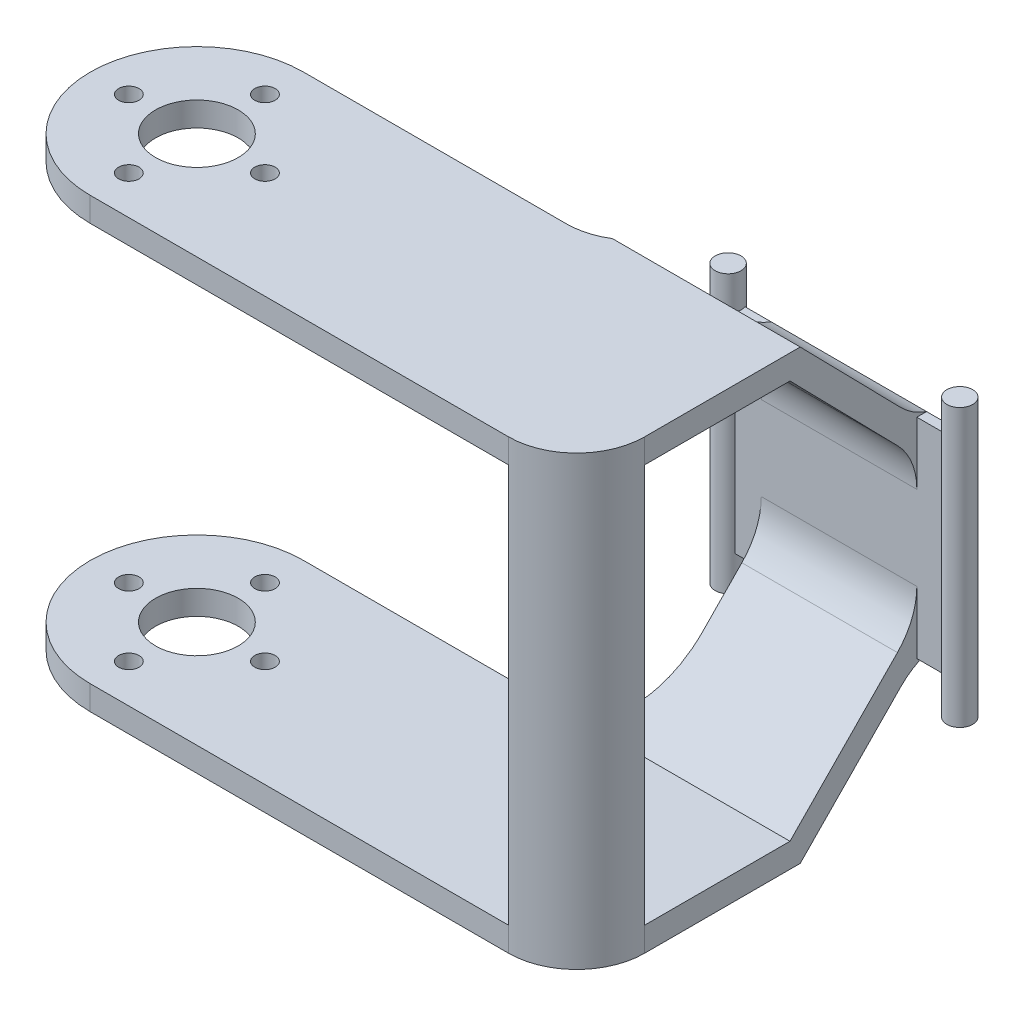
from build123d import *

# Parameters (mm, degrees)
SKETCH1_W           = 23.83
SKETCH1_H           = 1
BOSS_EXTRUDE1_DEPTH = 21.5
SKETCH2_R           = 1.325
BOSS_EXTRUDE2_DEPTH = 14.25
BOSS_EXTRUDE4_DEPTH = 8
SKETCH5_W           = 21.949336604
SKETCH5_H           = 2.5
BOSS_EXTRUDE5_DEPTH = 45
SKETCH6_R           = 4.25
SKETCH6_R_2         = 1.05
CUT_EXTRUDE1_DEPTH  = 79.646360374
FILLET1_R           = 7
FILLET2_R           = 7
FILLET3_R           = 7
BOSS_EXTRUDE6_START = 41
BOSS_EXTRUDE6_DEPTH = 41


with BuildPart() as part:
    # Sketch1 → Boss-Extrude1 (new body)
    with BuildSketch(Plane(origin=(0, 0, 0), x_dir=(1, 0, 0), z_dir=(0, 1, 0))):
        Rectangle(SKETCH1_W, SKETCH1_H)
    extrude(amount=BOSS_EXTRUDE1_DEPTH)

    # Sketch2 → Boss-Extrude2 (add, symmetric)
    with BuildSketch(Plane(origin=(0, 10.75, 0), x_dir=(1, 0, 0), z_dir=(0, 1, 0))):
        with Locations(Location((-11.915, 0, 0), (0, 0, 270))):
            Circle(SKETCH2_R)
        with Locations(Location((11.915, 0, 0), (0, 0, 270))):
            Circle(SKETCH2_R)
    extrude(amount=BOSS_EXTRUDE2_DEPTH, both=True)

    # Sketch4 → Boss-Extrude4 (add, symmetric)
    with BuildSketch(Plane(origin=(0, 0, 0), x_dir=(0, 0, -1), z_dir=(1, 0, 0))):
        Polygon((-0.5, 17.927447783), (-0.5, 21.5), (-12.5, 33.75), (-35.5, 33.75), (-35.5, 31.25), (-13.550663396, 31.25), align=None)
        Polygon((-0.5, 0), (-0.5, 3.572552217), (-13.550663396, -9.75), (-35.5, -9.75), (-35.5, -12.25), (-12.5, -12.25), align=None)
    extrude(amount=BOSS_EXTRUDE4_DEPTH, both=True)

    # Sketch5 → Boss-Extrude5 (add)
    with BuildSketch(Plane.ZY.offset(8)):
        with Locations((24.525331698, 32.5)):
            Rectangle(SKETCH5_W, SKETCH5_H)
        with Locations((24.525331698, -11)):
            Rectangle(SKETCH5_W, SKETCH5_H)
    extrude(amount=BOSS_EXTRUDE5_DEPTH)

    # Sketch6 → Cut-Extrude1 (cut, through all)
    with BuildSketch(Plane(origin=(0, 33.75, 0), x_dir=(1, 0, 0), z_dir=(0, 1, 0))):
        with Locations(Location((-42.025331698, -24.525331698, 0), (0, 0, 270))):
            Circle(SKETCH6_R)
        with Locations(Location((-49.025331698, -24.525331698, 0), (0, 0, 270))):
            Circle(SKETCH6_R_2)
        with Locations(Location((-42.025331698, -17.525331698, 0), (0, 0, 270))):
            Circle(SKETCH6_R_2)
        with Locations(Location((-35.025331698, -24.525331698, 0), (0, 0, 270))):
            Circle(SKETCH6_R_2)
        with Locations(Location((-42.025331698, -31.525331698, 0), (0, 0, 270))):
            Circle(SKETCH6_R_2)
        with BuildLine():
            ThreePointArc((-53, -24.525331698), (-49.785594076, -16.76506932), (-42.025331698, -13.550663396))
            Line((-42.025331698, -13.550663396), (-53, -13.550663396))
            Line((-53, -13.550663396), (-53, -24.525331698))
        make_face()
        with BuildLine():
            ThreePointArc((-42.025331698, -35.5), (-49.785594076, -32.285594076), (-53, -24.525331698))
            Line((-53, -24.525331698), (-53, -35.5))
            Line((-53, -35.5), (-42.025331698, -35.5))
        make_face()
    extrude(amount=-CUT_EXTRUDE1_DEPTH, mode=Mode.SUBTRACT)

    # Fillet1
    # the kernel refuses this fillet: 7 mm, written as the material it adds along each edge
    with BuildSketch(Plane(origin=(-8, -12.25, 13.550663396), x_dir=(-1, 0, 0), z_dir=(0, 1, 0))) as fillet1_piece_1_section:
        with BuildLine():
            CenterArc((FILLET1_R, -FILLET1_R), FILLET1_R, 90, 90)
            Line((0, -FILLET1_R), (0, 0))
            Line((0, 0), (FILLET1_R, 0))
        make_face()
    fillet1_piece_1 = extrude(amount=2.5, mode=Mode.PRIVATE)
    fillet1_piece_1 = split(fillet1_piece_1, bisect_by=Plane(origin=(-10.015975833, -11.661011889, 11.923032054), z_dir=(0, 0.699779834816443, 0.7143585813751185)), keep=Keep.TOP, mode=Mode.PRIVATE)
    fillet1_piece_1 = split(fillet1_piece_1, bisect_by=Plane(origin=(-10.015975833, -9.911562302, 13.708928508), z_dir=(0, -0.6997798348164429, -0.7143585813751187)), keep=Keep.TOP, mode=Mode.PRIVATE)
    add(fillet1_piece_1)
    with BuildSketch(Plane(origin=(-8, -12.25, 13.550663396), x_dir=(-1, 0, 0), z_dir=(0, 1, 0))) as fillet1_piece_2_section:
        with BuildLine():
            CenterArc((FILLET1_R, -FILLET1_R), FILLET1_R, 90, 90)
            Line((0, -FILLET1_R), (0, 0))
            Line((0, 0), (FILLET1_R, 0))
        make_face()
    fillet1_piece_2 = extrude(amount=20, mode=Mode.PRIVATE)
    fillet1_piece_2 = split(fillet1_piece_2, bisect_by=Plane(origin=(-8.812454151, -9.294822672, 9.605132414), z_dir=(0, 0.699779834816443, 0.7143585813751185)), keep=Keep.TOP, mode=Mode.PRIVATE)
    fillet1_piece_2 = split(fillet1_piece_2, bisect_by=Plane(origin=(-8.812454151, -9.75, 10.768831879), z_dir=(0, 1, 0)), keep=Keep.TOP, mode=Mode.PRIVATE)
    fillet1_piece_2 = split(fillet1_piece_2, bisect_by=Plane(origin=(-8.812454151, -7.545373085, 11.391028867), z_dir=(0, -0.6997798348164429, -0.7143585813751187)), keep=Keep.TOP, mode=Mode.PRIVATE)
    add(fillet1_piece_2)
    with BuildSketch(Plane(origin=(-8, 33.75, 13.550663396), x_dir=(0, 0, -1), z_dir=(0, -1, 0))) as fillet1_piece_3_section:
        with BuildLine():
            CenterArc((FILLET1_R, -FILLET1_R), FILLET1_R, 90, 90)
            Line((0, -FILLET1_R), (0, 0))
            Line((0, 0), (FILLET1_R, 0))
        make_face()
    fillet1_piece_3 = extrude(amount=2.5, mode=Mode.PRIVATE)
    fillet1_piece_3 = split(fillet1_piece_3, bisect_by=Plane(origin=(-10.015975833, 31.411562301, 13.708928507), z_dir=(0, 0.6997798348164431, -0.7143585813751184)), keep=Keep.TOP, mode=Mode.PRIVATE)
    fillet1_piece_3 = split(fillet1_piece_3, bisect_by=Plane(origin=(-10.015975833, 33.161011889, 11.923032054), z_dir=(0, -0.699779834816443, 0.7143585813751185)), keep=Keep.TOP, mode=Mode.PRIVATE)
    add(fillet1_piece_3)
    with BuildSketch(Plane(origin=(-8, 33.75, 13.550663396), x_dir=(0, 0, -1), z_dir=(0, -1, 0))) as fillet1_piece_4_section:
        with BuildLine():
            CenterArc((FILLET1_R, -FILLET1_R), FILLET1_R, 90, 90)
            Line((0, -FILLET1_R), (0, 0))
            Line((0, 0), (FILLET1_R, 0))
        make_face()
    fillet1_piece_4 = extrude(amount=20, mode=Mode.PRIVATE)
    fillet1_piece_4 = split(fillet1_piece_4, bisect_by=Plane(origin=(-8.812454159, 29.045373088, 11.39102887), z_dir=(0, 0.6997798348164431, -0.7143585813751184)), keep=Keep.TOP, mode=Mode.PRIVATE)
    fillet1_piece_4 = split(fillet1_piece_4, bisect_by=Plane(origin=(-8.812454159, 30.794822675, 9.605132416), z_dir=(0, -0.699779834816443, 0.7143585813751185)), keep=Keep.TOP, mode=Mode.PRIVATE)
    fillet1_piece_4 = split(fillet1_piece_4, bisect_by=Plane(origin=(-8.812454159, 31.25, 10.768831882), z_dir=(0, -1, 0)), keep=Keep.TOP, mode=Mode.PRIVATE)
    add(fillet1_piece_4)
    # the kernel refuses this fillet: 7 mm, written as the material it takes off along each edge
    with BuildSketch(Plane(origin=(8, 7.75, 35.5), x_dir=(0, 0, -1), z_dir=(0, -1, 0))) as fillet1_2_piece_1:
        with BuildLine():
            CenterArc((FILLET1_R, -FILLET1_R), FILLET1_R, 90, 90)
            Line((0, -FILLET1_R), (0, 0))
            Line((0, 0), (FILLET1_R, 0))
        make_face()
    extrude(amount=37.5, mode=Mode.SUBTRACT)
    with BuildSketch(Plane(origin=(8, 51.25, 35.5), x_dir=(-1, 0, 0), z_dir=(0, -1, 0))) as fillet1_2_piece_2:
        with BuildLine():
            CenterArc((FILLET1_R, FILLET1_R), FILLET1_R, 180, 90)
            Line((0, FILLET1_R), (0, 0))
            Line((0, 0), (FILLET1_R, 0))
        make_face()
    extrude(amount=37.5, mode=Mode.SUBTRACT)

    # Fillet2
    fillet2_edges = [part.edges().sort_by_distance(p)[0] for p in [
        (0, 17.927447783, 0.5),
        (0, 3.572552217, 0.5),
    ]]
    fillet(fillet2_edges, radius=FILLET2_R)

    # Fillet3
    # the kernel refuses this fillet: 7 mm, written as the material it adds along each edge
    with BuildSketch(Plane(origin=(-8, 21.5, 0.5), x_dir=(0, 0.7143585813744706, 0.6997798348171044), z_dir=(1, 0, 0))) as fillet3_piece_1:
        with BuildLine():
            CenterArc((2.380920079, -7), FILLET3_R, 90, 26.110260914)
            Line((-0.699779835, -0.714358581), (0, 0))
            Line((0, 0), (2.380920079, 0))
        make_face()
    extrude(amount=16)
    with BuildSketch(Plane(origin=(8, 0, 0.5), x_dir=(0, 0, -1), z_dir=(-1, 0, 0))) as fillet3_piece_2:
        with BuildLine():
            CenterArc((3.33439021, 6.599289533), FILLET3_R, 224.409342785, 26.110260914)
            Line((-1.666119859, 1.70083069), (0, 0))
            Line((0, 0), (1, 0))
        make_face()
    extrude(amount=16)

    # Sketch8 → Boss-Extrude6 (add)
    with BuildSketch(Plane(origin=(0, -9.75, 0), x_dir=(1, 0, 0), z_dir=(0, 1, 0)).offset(BOSS_EXTRUDE6_START)):
        with BuildLine():
            ThreePointArc((1, -35.5), (5.949747468, -33.449747468), (8, -28.5))
            Line((8, -28.5), (5, -28.5))
            ThreePointArc((5, -28.5), (3.422054899, -30.922054899), (1, -32.5))
            Line((1, -32.5), (1, -35.5))
        make_face()
    extrude(amount=-BOSS_EXTRUDE6_DEPTH)


solid = part.part
